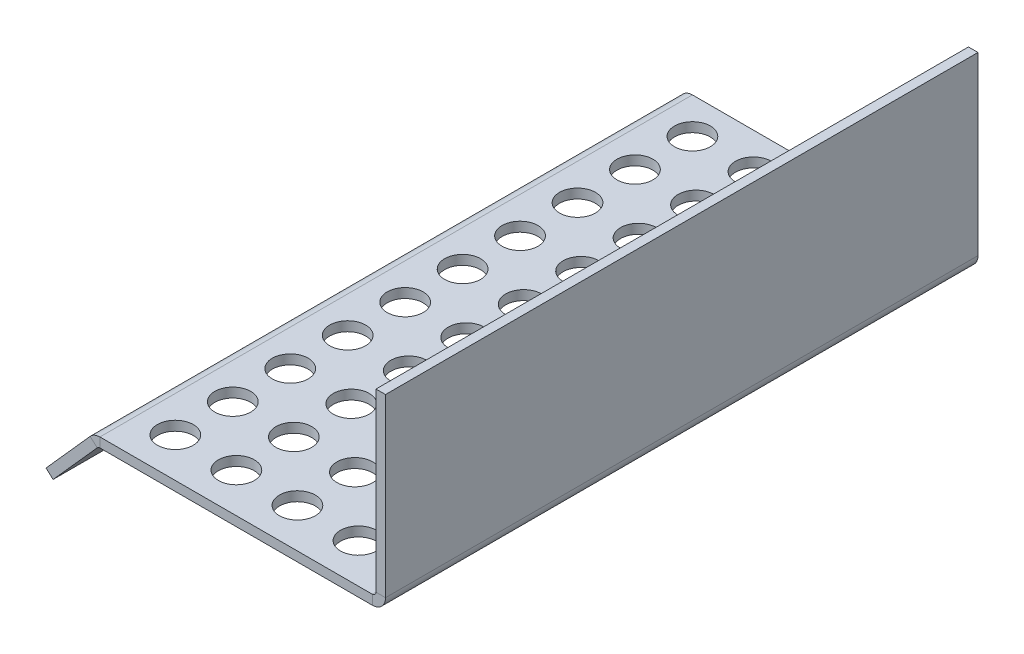
from build123d import *

# Parameters (mm, degrees)
BASE_FLANGE1_DEPTH = 82.5
SKETCH2_R          = 5
CUT_EXTRUDE1_DEPTH = 134.230513755


# Sheet-metal steps are written as plain solids
with BuildPart() as part:
    # Sketch1 → Base-Flange1 (new, symmetric)
    with BuildSketch(Plane.XY):
        with BuildLine():
            Line((-91.891891892, 135), (-79.604112678, 148.777206997))
            ThreePointArc((-79.604112678, 148.777206997), (-78.370281896, 149.6803294), (-76.875029682, 150))
            Line((-76.875029682, 150), (-1, 150))
            ThreePointArc((-1, 150), (-0.292893219, 150.292893219), (0, 151))
            Line((0, 151), (0, 200))
            Line((0, 200), (2.65684, 200))
            Line((2.65684, 200), (2.65684, 151))
            ThreePointArc((2.65684, 151), (1.585776362, 148.414223638), (-1, 147.34316))
            Line((-1, 147.34316), (-76.875029682, 147.34316))
            ThreePointArc((-76.875029682, 147.34316), (-77.28392157, 147.255742831), (-77.621325116, 147.008774847))
            Line((-77.621325116, 147.008774847), (-89.90910433, 133.23156785))
            Line((-89.90910433, 133.23156785), (-91.891891892, 135))
        make_face()
    extrude(amount=BASE_FLANGE1_DEPTH, both=True)

    # Sketch2 → Cut-Extrude1 (cut, through all)
    with BuildSketch(Plane(origin=(0, 150, 0), x_dir=(1, 0, 0), z_dir=(0, 1, 0))):
        with Locations(Location((-66.875029682, 72.5, 0), (0, 0, 270))):
            Circle(SKETCH2_R)
        with Locations(Location((-49.875029682, 72.5, 0), (0, 0, 270))):
            Circle(SKETCH2_R)
        with Locations(Location((-32.875029682, 72.5, 0), (0, 0, 270))):
            Circle(SKETCH2_R)
        with Locations(Location((-15.875029682, 72.5, 0), (0, 0, 270))):
            Circle(SKETCH2_R)
        with Locations(Location((-66.875029682, 56.5, 0), (0, 0, 270))):
            Circle(SKETCH2_R)
        with Locations(Location((-49.875029682, 56.5, 0), (0, 0, 270))):
            Circle(SKETCH2_R)
        with Locations(Location((-32.875029682, 56.5, 0), (0, 0, 270))):
            Circle(SKETCH2_R)
        with Locations(Location((-15.875029682, 56.5, 0), (0, 0, 270))):
            Circle(SKETCH2_R)
        with Locations(Location((-66.875029682, 40.5, 0), (0, 0, 270))):
            Circle(SKETCH2_R)
        with Locations(Location((-49.875029682, 40.5, 0), (0, 0, 270))):
            Circle(SKETCH2_R)
        with Locations(Location((-32.875029682, 40.5, 0), (0, 0, 270))):
            Circle(SKETCH2_R)
        with Locations(Location((-15.875029682, 40.5, 0), (0, 0, 270))):
            Circle(SKETCH2_R)
        with Locations(Location((-66.875029682, 24.5, 0), (0, 0, 270))):
            Circle(SKETCH2_R)
        with Locations(Location((-49.875029682, 24.5, 0), (0, 0, 270))):
            Circle(SKETCH2_R)
        with Locations(Location((-32.875029682, 24.5, 0), (0, 0, 270))):
            Circle(SKETCH2_R)
        with Locations(Location((-15.875029682, 24.5, 0), (0, 0, 270))):
            Circle(SKETCH2_R)
        with Locations(Location((-66.875029682, 8.5, 0), (0, 0, 270))):
            Circle(SKETCH2_R)
        with Locations(Location((-49.875029682, 8.5, 0), (0, 0, 270))):
            Circle(SKETCH2_R)
        with Locations(Location((-32.875029682, 8.5, 0), (0, 0, 270))):
            Circle(SKETCH2_R)
        with Locations(Location((-15.875029682, 8.5, 0), (0, 0, 270))):
            Circle(SKETCH2_R)
        with Locations(Location((-66.875029682, -7.5, 0), (0, 0, 270))):
            Circle(SKETCH2_R)
        with Locations(Location((-49.875029682, -7.5, 0), (0, 0, 270))):
            Circle(SKETCH2_R)
        with Locations(Location((-32.875029682, -7.5, 0), (0, 0, 270))):
            Circle(SKETCH2_R)
        with Locations(Location((-15.875029682, -7.5, 0), (0, 0, 270))):
            Circle(SKETCH2_R)
        with Locations(Location((-66.875029682, -23.5, 0), (0, 0, 270))):
            Circle(SKETCH2_R)
        with Locations(Location((-49.875029682, -23.5, 0), (0, 0, 270))):
            Circle(SKETCH2_R)
        with Locations(Location((-32.875029682, -23.5, 0), (0, 0, 270))):
            Circle(SKETCH2_R)
        with Locations(Location((-15.875029682, -23.5, 0), (0, 0, 270))):
            Circle(SKETCH2_R)
        with Locations(Location((-66.875029682, -39.5, 0), (0, 0, 270))):
            Circle(SKETCH2_R)
        with Locations(Location((-49.875029682, -39.5, 0), (0, 0, 270))):
            Circle(SKETCH2_R)
        with Locations(Location((-32.875029682, -39.5, 0), (0, 0, 270))):
            Circle(SKETCH2_R)
        with Locations(Location((-15.875029682, -39.5, 0), (0, 0, 270))):
            Circle(SKETCH2_R)
        with Locations(Location((-66.875029682, -55.5, 0), (0, 0, 270))):
            Circle(SKETCH2_R)
        with Locations(Location((-49.875029682, -55.5, 0), (0, 0, 270))):
            Circle(SKETCH2_R)
        with Locations(Location((-32.875029682, -55.5, 0), (0, 0, 270))):
            Circle(SKETCH2_R)
        with Locations(Location((-15.875029682, -55.5, 0), (0, 0, 270))):
            Circle(SKETCH2_R)
        with Locations(Location((-66.875029682, -71.5, 0), (0, 0, 270))):
            Circle(SKETCH2_R)
        with Locations(Location((-49.875029682, -71.5, 0), (0, 0, 270))):
            Circle(SKETCH2_R)
        with Locations(Location((-32.875029682, -71.5, 0), (0, 0, 270))):
            Circle(SKETCH2_R)
        with Locations(Location((-15.875029682, -71.5, 0), (0, 0, 270))):
            Circle(SKETCH2_R)
    extrude(amount=-CUT_EXTRUDE1_DEPTH, mode=Mode.SUBTRACT)


solid = part.part
